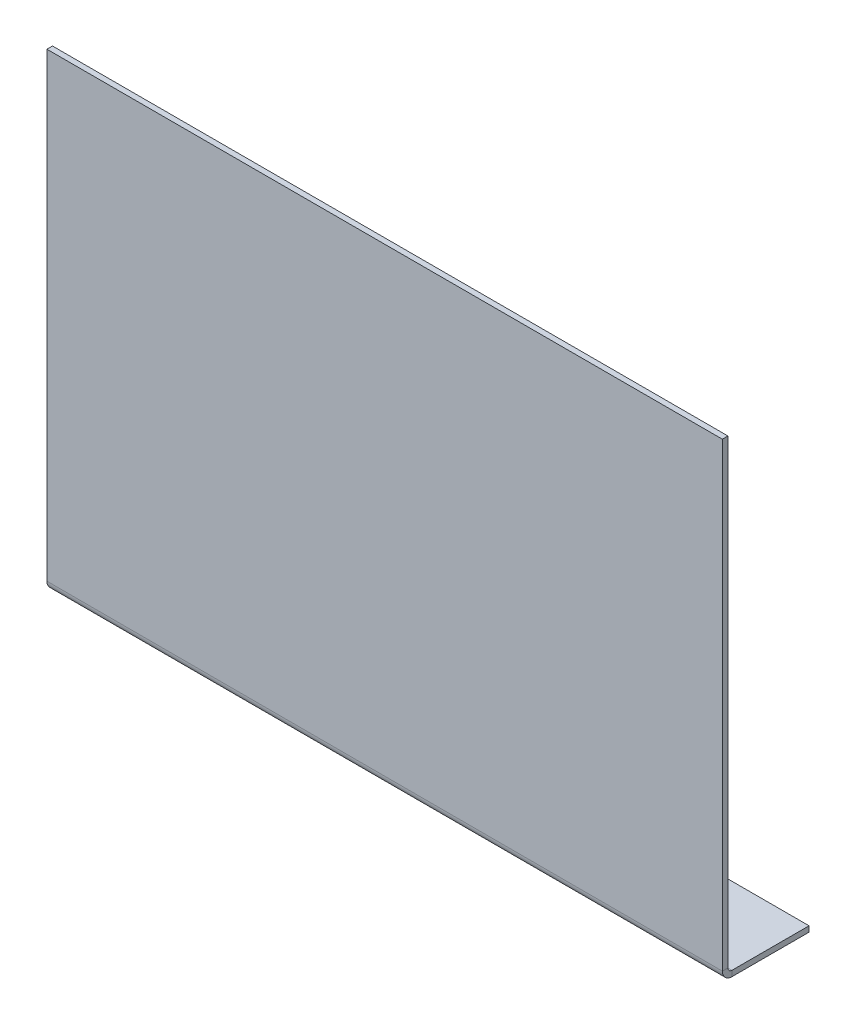
from build123d import *

# Parameters (mm, degrees)
SKETCH1_W              = 123.25
SKETCH1_H              = 100
SKETCH1_R              = 1.4732
BASE_FLANGE1_DEPTH     = 1.016
SKETCHED_BEND2_DEPTH   = 123.25
SKETCHED_BEND2_2_DEPTH = 123.25


# Read off the part's stored shape, not the designer's step: Sketched Bend2
# Sheet-metal steps are written as plain solids
with BuildPart() as part:
    # Sketch1 → Base-Flange1 (new body)
    with BuildSketch(Plane(origin=(0, 0, 0), x_dir=(1, 0, 0), z_dir=(0, 1, 0))):
        with Locations((61.625, -50)):
            Rectangle(SKETCH1_W, SKETCH1_H)
        with Locations(Location((29.125, -7, 0), (0, 0, 270))):
            Circle(SKETCH1_R, mode=Mode.SUBTRACT)
        with Locations(Location((94.125, -7, 0), (0, 0, 270))):
            Circle(SKETCH1_R, mode=Mode.SUBTRACT)
    extrude(amount=-BASE_FLANGE1_DEPTH)

    # Sketched Bend2 outline → Sketched Bend2 (cut)
    with BuildSketch(Plane.YZ):
        with BuildLine():
            ThreePointArc((-1.016, 14.062391673), (-0.740317723, 15.005959794), (0, 15.652683218))
            Line((0, 15.652683218), (0, 100))
            Line((0, 100), (-1.016, 100))
            Line((-1.016, 100), (-1.016, 14.062391673))
        make_face()
    extrude(amount=SKETCHED_BEND2_DEPTH, mode=Mode.SUBTRACT)

    # Sketched Bend2 2 outline → Sketched Bend2 2 (add)
    with BuildSketch(Plane.YZ):
        with BuildLine():
            ThreePointArc((0, 14.062391673), (0.215745145, 14.583246528), (0.7366, 14.798991673))
            Line((0.7366, 14.798991673), (84.798991673, 14.798991673))
            Line((84.798991673, 14.798991673), (84.798991673, 15.814991673))
            Line((84.798991673, 15.814991673), (0.7366, 15.814991673))
            ThreePointArc((0.7366, 15.814991673), (0.35946488, 15.773933627), (0, 15.652683218))
            Line((0, 15.652683218), (0, 14.062391673))
        make_face()
    extrude(amount=SKETCHED_BEND2_2_DEPTH)


solid = part.part
